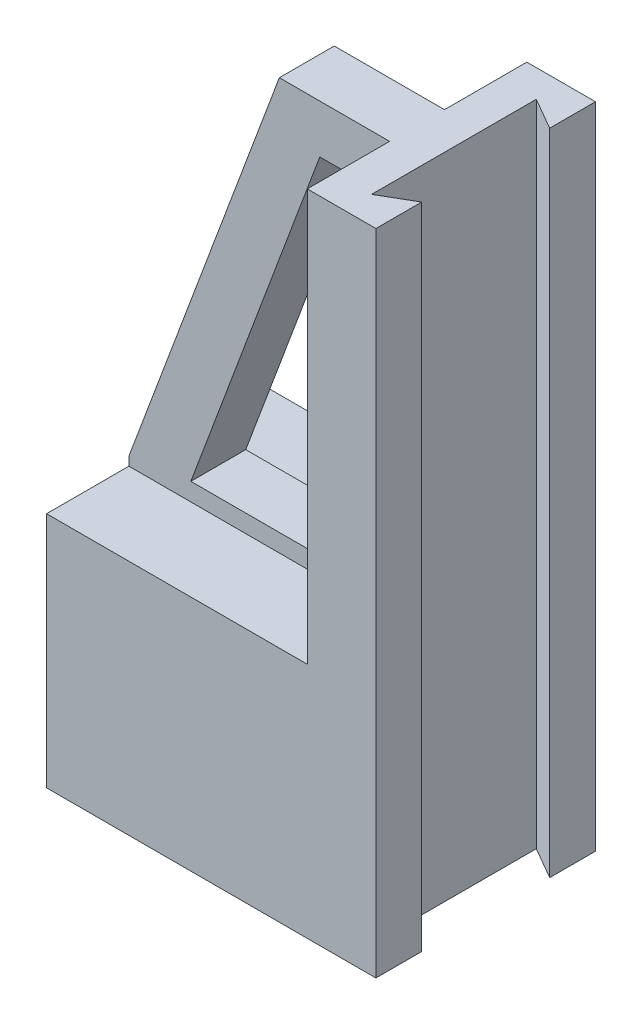
from build123d import *

# Parameters (mm, degrees)
EXTRUDE_1_DEPTH     = 80
SKETCH_2_W          = 95
SKETCH_2_H          = 30
CUT_EXTRUDE_1_DEPTH = 150
CUT_EXTRUDE_2_DEPTH = 278.011022083


with BuildPart() as part:
    # Эскиз1 → Бобышка-Вытянуть1 (new body)
    with BuildSketch(Plane.XY):
        Polygon((0, 0), (120, 0), (120, 236.506038729), (54.820820334, 236.506038729), (0, 89.665516339), align=None)
        Polygon((22.574148337, 93.007088377), (69.564384314, 218.872968455), (93.56401705, 218.872968455), (93.56401705, 93.007088377), align=None, mode=Mode.SUBTRACT)
    extrude(amount=EXTRUDE_1_DEPTH)

    # Эскиз2 → Вырез-Вытянуть1 (cut)
    with BuildSketch(Plane(origin=(0, 236.506038729, 0), x_dir=(1, 0, 0), z_dir=(0, 1, 0))):
        with Locations((47.5, -15)):
            Rectangle(SKETCH_2_W, SKETCH_2_H)
        with Locations((47.5, -65)):
            Rectangle(SKETCH_2_W, SKETCH_2_H)
    extrude(amount=-CUT_EXTRUDE_1_DEPTH, mode=Mode.SUBTRACT)

    # Эскиз3 → Вырез-Вытянуть2 (cut, through all)
    with BuildSketch(Plane(origin=(0, 236.506038729, 0), x_dir=(1, 0, 0), z_dir=(0, 1, 0))):
        Polygon((108.441945131, -10), (108.441945131, -70), (120, -63.32695391), (120, -16.67304609), align=None)
    extrude(amount=-CUT_EXTRUDE_2_DEPTH, mode=Mode.SUBTRACT)


solid = part.part
